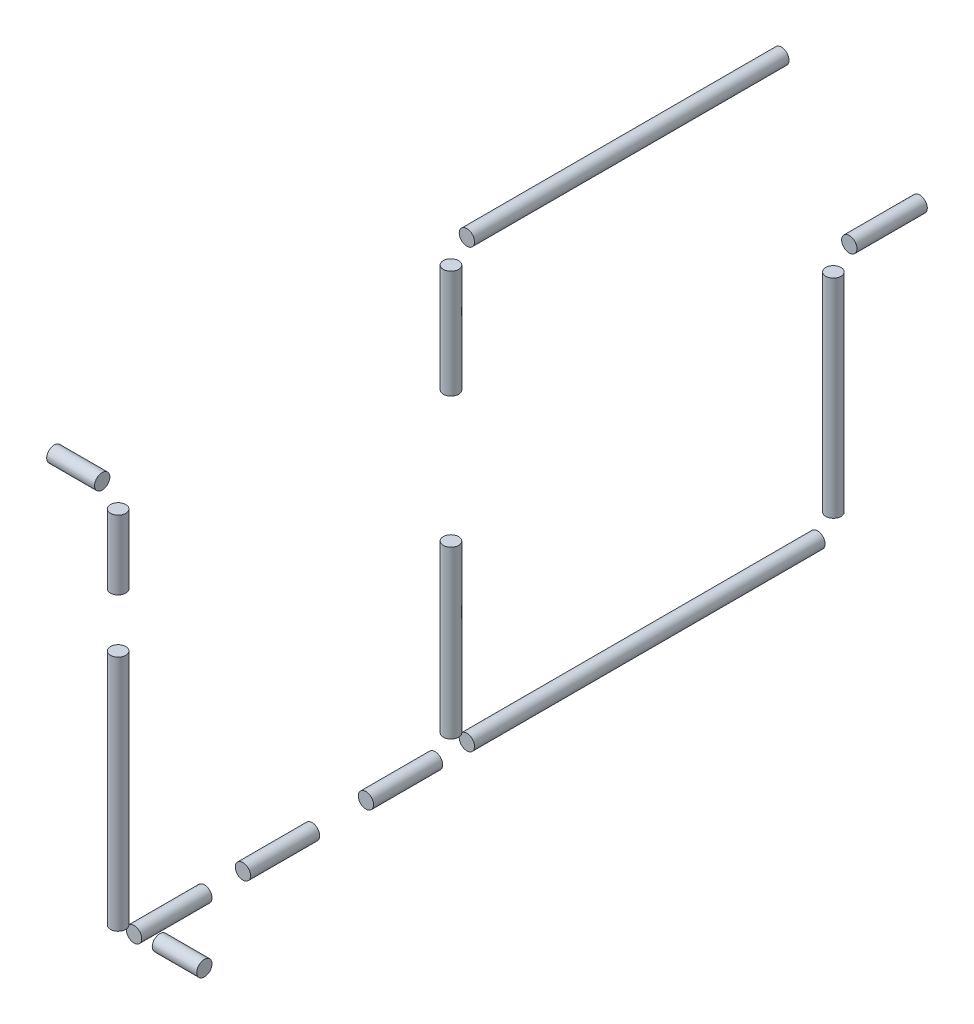
from build123d import *

# Parameters (mm, degrees)
BOSS_EXTRUDE1_START     = -261.091901869
BOSS_EXTRUDE1_OUTLINE_R = 6.35
BOSS_EXTRUDE1_DEPTH     = 261.091901869
SKETCH3_R               = 6.35
BOSS_EXTRUDE2_DEPTH     = 89.839846195
SKETCH4_R               = 6.35
BOSS_EXTRUDE3_DEPTH     = 137.9728
SKETCH5_R               = 6.35
BOSS_EXTRUDE4_DEPTH     = 291.084
SKETCH6_R               = 6.35
BOSS_EXTRUDE5_DEPTH     = 172.720000001
SKETCH7_R               = 6.35
BOSS_EXTRUDE6_DEPTH     = 58.42
SKETCH8_R               = 6.35
BOSS_EXTRUDE7_DEPTH     = 57.404
SKETCH9_R               = 6.35
BOSS_EXTRUDE8_DEPTH     = 57.404
SKETCH10_R              = 6.35
BOSS_EXTRUDE9_DEPTH     = 36.950997131
SKETCH11_R              = 6.35
BOSS_EXTRUDE10_DEPTH    = 58.42
SKETCH12_R              = 6.35
BOSS_EXTRUDE11_DEPTH    = 197.104
SKETCH13_R              = 6.35
BOSS_EXTRUDE12_DEPTH    = 57.404
SKETCH14_R              = 6.35
BOSS_EXTRUDE13_DEPTH    = 39.744997131


# Read off the part's stored shape, not the designer's step: Boss-Extrude1
with BuildPart() as part:
    # Boss-Extrude1 outline → Boss-Extrude1 (new body)
    with BuildSketch(Plane(origin=(0, 0, -22.86), x_dir=(-1, 0, 0), z_dir=(0, 0, -1)).offset(BOSS_EXTRUDE1_START)):
        with Locations((36.068, 0)):
            Circle(BOSS_EXTRUDE1_OUTLINE_R)
    extrude(amount=BOSS_EXTRUDE1_DEPTH)


with BuildPart() as body_2:
    # Sketch3 → Boss-Extrude2 (new body)
    with BuildSketch(Plane(origin=(0, -13.208, 0), x_dir=(1, 0, 0), z_dir=(0, 1, 0))):
        with Locations(Location((-36.068, -251.439901869, 0), (0, 0, 270))):
            Circle(SKETCH3_R)
    extrude(amount=-BOSS_EXTRUDE2_DEPTH)


with BuildPart() as body_3:
    # Sketch4 → Boss-Extrude3 (new body)
    with BuildSketch(Plane(origin=(0, -211.639846435, 0), x_dir=(1, 0, 0), z_dir=(0, 1, 0))):
        with Locations(Location((-36.068, -251.439901869, 0), (0, 0, 270))):
            Circle(SKETCH4_R)
    extrude(amount=-BOSS_EXTRUDE3_DEPTH)


with BuildPart() as body_4:
    # Sketch5 → Boss-Extrude4 (new body)
    with BuildSketch(Plane.XY.offset(238.231901869)):
        with Locations((-36.068, -362.820646437)):
            Circle(SKETCH5_R)
    extrude(amount=-BOSS_EXTRUDE4_DEPTH)


with BuildPart() as body_5:
    # Sketch6 → Boss-Extrude5 (new body)
    with BuildSketch(Plane(origin=(0, -349.612646437, 0), x_dir=(1, 0, 0), z_dir=(0, 1, 0))):
        with Locations((-36.068, 66.060098131)):
            Circle(SKETCH6_R)
    extrude(amount=BOSS_EXTRUDE5_DEPTH)


with BuildPart() as body_6:
    # Sketch7 → Boss-Extrude6 (new body)
    with BuildSketch(Plane.XY.offset(-79.268098131)):
        with Locations((-36.068, -163.684646435)):
            Circle(SKETCH7_R)
    extrude(amount=-BOSS_EXTRUDE6_DEPTH)


with BuildPart() as body_7:
    # Sketch8 → Boss-Extrude7 (new body)
    with BuildSketch(Plane.XY.offset(264.647901869)):
        with Locations((-36.068, -362.820646435)):
            Circle(SKETCH8_R)
    extrude(amount=BOSS_EXTRUDE7_DEPTH)


with BuildPart() as body_8:
    # Sketch9 → Boss-Extrude8 (new body)
    with BuildSketch(Plane.XY.offset(366.755901869)):
        with Locations((-36.068, -362.820646437)):
            Circle(SKETCH9_R)
    extrude(amount=BOSS_EXTRUDE8_DEPTH)


with BuildPart() as body_9:
    # Sketch10 → Boss-Extrude9 (new body)
    with BuildSketch(Plane(origin=(-89.020997131, 0, 0), x_dir=(0, 0, -1), z_dir=(1, 0, 0))):
        with Locations(Location((-440.161901869, -432.403946437, 0), (0, 0, 180))):
            Circle(SKETCH10_R)
    extrude(amount=BOSS_EXTRUDE9_DEPTH)


with BuildPart() as body_10:
    # Sketch11 → Boss-Extrude10 (new body)
    with BuildSketch(Plane.XY.offset(456.163901869)):
        with Locations(Location((-36.068, -362.820646437, 0), (0, 0, 180))):
            Circle(SKETCH11_R)
    extrude(amount=BOSS_EXTRUDE10_DEPTH)


with BuildPart() as body_11:
    # Sketch12 → Boss-Extrude11 (new body)
    with BuildSketch(Plane(origin=(0, -349.612646437, 0), x_dir=(1, 0, 0), z_dir=(0, 1, 0))):
        with Locations(Location((-36.068, -527.791901869, 0), (0, 0, 90))):
            Circle(SKETCH12_R)
    extrude(amount=BOSS_EXTRUDE11_DEPTH)


with BuildPart() as body_12:
    # Sketch13 → Boss-Extrude12 (new body)
    with BuildSketch(Plane(origin=(0, -107.804646437, 0), x_dir=(1, 0, 0), z_dir=(0, 1, 0))):
        with Locations(Location((-36.068, -527.791901869, 0), (0, 0, 270))):
            Circle(SKETCH13_R)
    extrude(amount=BOSS_EXTRUDE12_DEPTH)


with BuildPart() as body_13:
    # Sketch14 → Boss-Extrude13 (new body)
    with BuildSketch(Plane(origin=(-49.276, 0, 0), x_dir=(0, 0, -1), z_dir=(1, 0, 0))):
        with Locations((-527.791901869, -37.192646437)):
            Circle(SKETCH14_R)
    extrude(amount=-BOSS_EXTRUDE13_DEPTH)


solid = Compound([part.part, body_2.part, body_3.part, body_4.part, body_5.part, body_6.part, body_7.part, body_8.part, body_9.part, body_10.part, body_11.part, body_12.part, body_13.part])
